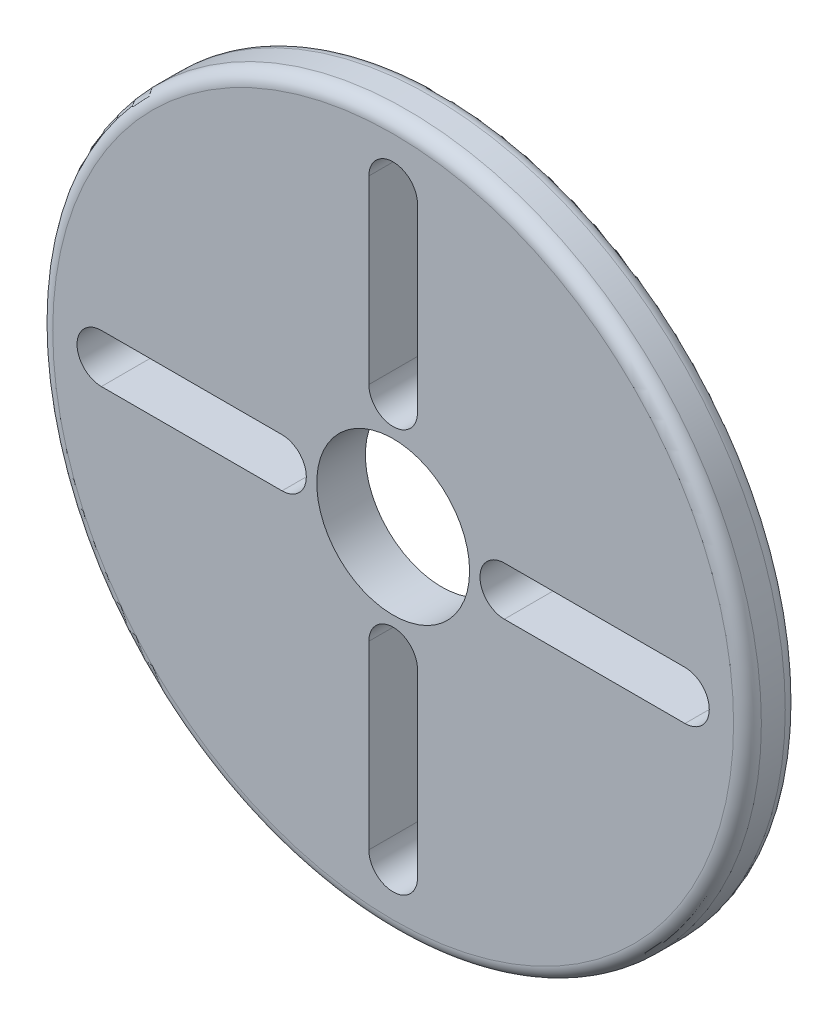
from build123d import *

# Parameters (mm, degrees)
SKETCH1_R               = 25.5
SKETCH1_R_2             = 5.5
BOSS_EXTRUDE1_DEPTH     = 3.5
CUT_EXTRUDE1_DEPTH      = 37.231892029
CUT_EXTRUDE1_DEPTH_BACK = 37.231892029
FILLET2_R               = 1


with BuildPart() as part:
    # Sketch1 → Boss-Extrude1 (new body)
    with BuildSketch(Plane.XY):
        Circle(SKETCH1_R)
        Circle(SKETCH1_R_2, mode=Mode.SUBTRACT)
    extrude(amount=BOSS_EXTRUDE1_DEPTH)

    # Sketch8 → Revolve2 (revolve)
    with BuildSketch(Plane(origin=(0, 0, 0), x_dir=(1, 0, 0), z_dir=(0, 1, 0))):
        Polygon((-11.5, 0), (-11.5, 3.5), (-25.5, 0), align=None)
    revolve(axis=Axis((0, 0, 0), (0, 0, 1)))

    # Sketch7 → Cut-Extrude1 (cut, two sides: drawn at the far end of the back side and taken through both)
    with BuildSketch(Plane.XY.offset(-CUT_EXTRUDE1_DEPTH_BACK)):
        with BuildLine():
            Line((1.75, -21), (1.75, -8))
            ThreePointArc((1.75, -8), (0, -6.25), (-1.75, -8))
            Line((-1.75, -8), (-1.75, -21))
            ThreePointArc((-1.75, -21), (0, -22.75), (1.75, -21))
        make_face()
        with BuildLine():
            Line((-21, -1.75), (-8, -1.75))
            ThreePointArc((-8, -1.75), (-6.25, 0), (-8, 1.75))
            Line((-8, 1.75), (-21, 1.75))
            ThreePointArc((-21, 1.75), (-22.75, 0), (-21, -1.75))
        make_face()
        with BuildLine():
            Line((-1.75, 21), (-1.75, 8))
            ThreePointArc((-1.75, 8), (0, 6.25), (1.75, 8))
            Line((1.75, 8), (1.75, 21))
            ThreePointArc((1.75, 21), (0, 22.75), (-1.75, 21))
        make_face()
        with BuildLine():
            Line((21, 1.75), (8, 1.75))
            ThreePointArc((8, 1.75), (6.25, 0), (8, -1.75))
            Line((8, -1.75), (21, -1.75))
            ThreePointArc((21, -1.75), (22.75, 0), (21, 1.75))
        make_face()
    extrude(amount=CUT_EXTRUDE1_DEPTH + CUT_EXTRUDE1_DEPTH_BACK, mode=Mode.SUBTRACT)

    # Fillet2
    fillet2_edges = [part.edges().sort_by_distance(p)[0] for p in [
        (-25.5, 0, 3.5),
        (0, 25.5, 0),
    ]]
    fillet(fillet2_edges, radius=FILLET2_R)


solid = part.part
